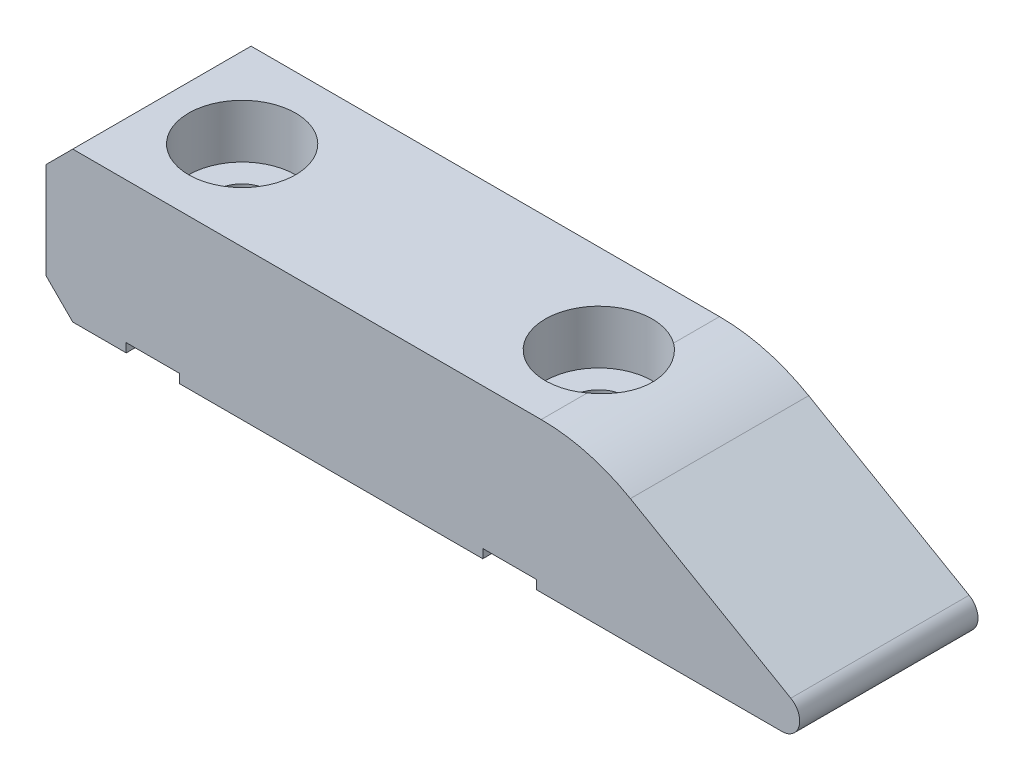
from build123d import *

# Parameters (mm, degrees)
EXTRUDE_1_DEPTH     = 5
SKETCH_2_R          = 1.5
CUT_EXTRUDE_1_DEPTH = 47.049538543
SKETCH_3_R          = 3
CUT_EXTRUDE_2_DEPTH = 3
FILLET_1_R          = 10
FILLET_2_R          = 1
CHAMFER_1_SIZE      = 1.5
SKETCH_4_W          = 3
SKETCH_4_H          = 10
SKETCH_4_W_2        = 3.010676302
CUT_EXTRUDE_3_DEPTH = 0.5


with BuildPart() as part:
    # 草图1 → 凸台-拉伸1 (new, symmetric)
    with BuildSketch(Plane.XY):
        Polygon((0, 0), (-14.549226784, 8.4), (-45, 8.4), (-45, 0), align=None)
    extrude(amount=EXTRUDE_1_DEPTH, both=True)

    # 草图2 → 切除-拉伸1 (cut, through all)
    with BuildSketch(Plane(origin=(0, 8.4, 0), x_dir=(1, 0, 0), z_dir=(0, 1, 0))):
        with Locations(Location((-39, 0, 0), (0, 0, 180))):
            Circle(SKETCH_2_R)
        with Locations(Location((-19, 0, 0), (0, 0, 180))):
            Circle(SKETCH_2_R)
    extrude(amount=-CUT_EXTRUDE_1_DEPTH, mode=Mode.SUBTRACT)

    # 草图3 → 切除-拉伸2 (cut)
    with BuildSketch(Plane(origin=(0, 8.4, 0), x_dir=(1, 0, 0), z_dir=(0, 1, 0))):
        with Locations(Location((-39, 0, 0), (0, 0, 180))):
            Circle(SKETCH_3_R)
        with Locations(Location((-19, 0, 0), (0, 0, 180))):
            Circle(SKETCH_3_R)
    extrude(amount=-CUT_EXTRUDE_2_DEPTH, mode=Mode.SUBTRACT)

    # 圆角1
    # the kernel refuses this fillet: 10 mm, written as the material it takes off along each edge
    with BuildSketch(Plane(origin=(-14.549226784, 8.4, -11.698729811), x_dir=(0.8660254037844417, -0.4999999999999948, 0), z_dir=(0, 0, 1))) as fillet_1_piece_1:
        with BuildLine():
            CenterArc((FILLET_1_R * 0.267949192431, -FILLET_1_R), FILLET_1_R, 90, 30)
            Line((-FILLET_1_R * 0.232050807569, -FILLET_1_R * 0.133974596216), (0, 0))
            Line((0, 0), (FILLET_1_R * 0.267949192431, 0))
        make_face()
    extrude(amount=23.397459622, mode=Mode.SUBTRACT)

    # 圆角2
    fillet_2_edges = [part.edges().sort_by_distance(p)[0] for p in [
        (0, 0, 0),
    ]]
    fillet(fillet_2_edges, radius=FILLET_2_R)

    # 倒角1
    chamfer_1_edges = [part.edges().sort_by_distance(p)[0] for p in [
        (-45, 0, 0),
        (-45, 8.4, 0),
    ]]
    chamfer(chamfer_1_edges, length=CHAMFER_1_SIZE)

    # 草图4 → 切除-拉伸3 (cut)
    with BuildSketch(Plane.XZ):
        with Locations((-39, 0)):
            Rectangle(SKETCH_4_W, SKETCH_4_H)
        with Locations((-19, 0)):
            Rectangle(SKETCH_4_W_2, SKETCH_4_H)
    extrude(amount=-CUT_EXTRUDE_3_DEPTH, mode=Mode.SUBTRACT)


solid = part.part
